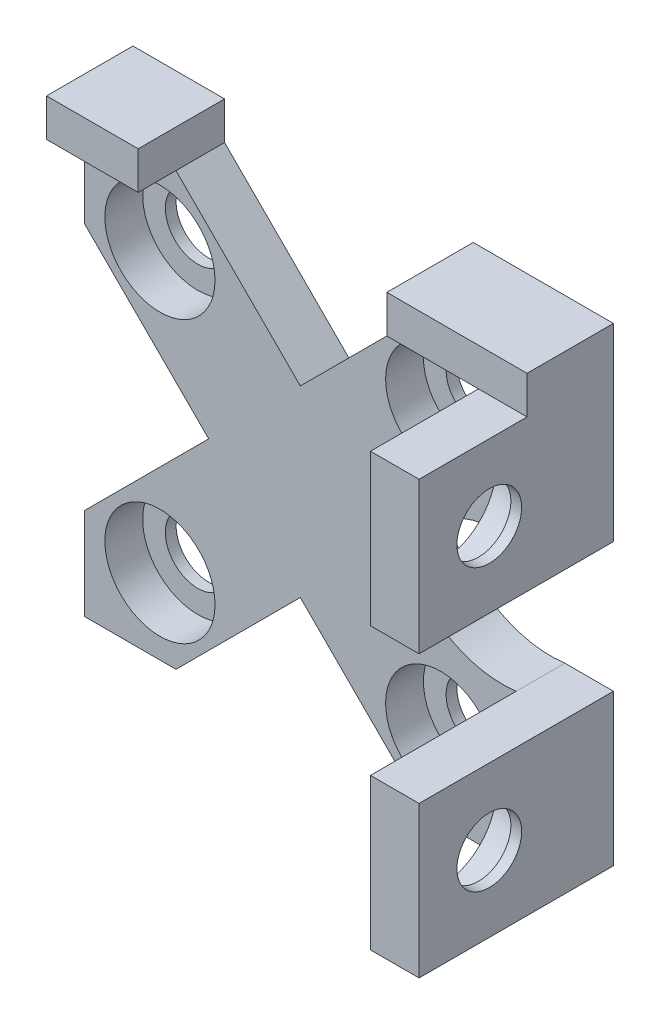
from build123d import *

# Parameters (mm, degrees)
RESSALTO_EXTRUS_O1_DEPTH  = 4.5
ESBO_O2_R                 = 5.1
CORTE_EXTRUS_O1_DEPTH     = 3.5
ESBO_O3_R                 = 3
CORTE_EXTRUS_O2_DEPTH     = 3.5
ESPELHAR2_COPY_1_DEPTH    = 4.5
ESPELHAR2_COPY_2_SKETCH_R = 5.1
ESPELHAR2_COPY_2_DEPTH    = 3.5
ESPELHAR2_COPY_3_SKETCH_R = 3
ESPELHAR2_COPY_3_DEPTH    = 3.5
ESBO_O5_W                 = 18
ESBO_O5_H                 = 14
RESSALTO_EXTRUS_O2_DEPTH  = 4.5
ESBO_O6_R                 = 5.15
CORTE_EXTRUS_O3_DEPTH     = 3.5
ESBO_O7_R                 = 3
CORTE_EXTRUS_O4_DEPTH     = 3.5
FILETE1_R                 = 10
ESBO_O8_W                 = 8.485281374
ESBO_O8_H                 = 8
ESBO_O8_W_2               = 12.985281374
RESSALTO_EXTRUS_O3_DEPTH  = 3.5


with BuildPart() as part:
    # Esboço1 → Ressalto-extrusão1 (new body)
    with BuildSketch(Plane.XY):
        Polygon((-8.485281374, 0), (-20, 11.514718626), (-20, 20), (-11.514718626, 20), (0, 8.485281374), (0, 0), align=None)
    ressalto_extrus_o1 = extrude(amount=RESSALTO_EXTRUS_O1_DEPTH)

    # Esboço2 → Corte-extrusão1 (cut)
    with BuildSketch(Plane.XY.offset(4.5)):
        with Locations((-13, 13)):
            Circle(ESBO_O2_R)
    corte_extrus_o1 = extrude(amount=-CORTE_EXTRUS_O1_DEPTH, mode=Mode.SUBTRACT)

    # Esboço3 → Corte-extrusão2 (cut)
    with BuildSketch(Plane.XY.offset(1)):
        with Locations((-13, 13)):
            Circle(ESBO_O3_R)
    corte_extrus_o2 = extrude(amount=-CORTE_EXTRUS_O2_DEPTH, mode=Mode.SUBTRACT)

    # Espelhar1: Ressalto-extrusão1, Corte-extrusão1, Corte-extrusão2 across plane
    add(ressalto_extrus_o1.mirror(Plane(origin=(0, 0, 0), x_dir=(0, 0, 1), z_dir=(1, 0, 0))))
    add(corte_extrus_o1.mirror(Plane(origin=(0, 0, 0), x_dir=(0, 0, 1), z_dir=(1, 0, 0))), mode=Mode.SUBTRACT)
    add(corte_extrus_o2.mirror(Plane(origin=(0, 0, 0), x_dir=(0, 0, 1), z_dir=(1, 0, 0))), mode=Mode.SUBTRACT)

    # Espelhar2: Ressalto-extrusão1, Corte-extrusão1, Corte-extrusão2 across plane
    add(ressalto_extrus_o1.mirror(Plane.ZX))
    add(corte_extrus_o1.mirror(Plane.ZX), mode=Mode.SUBTRACT)
    add(corte_extrus_o2.mirror(Plane.ZX), mode=Mode.SUBTRACT)

    # Espelhar2 copy 1 sketch → Espelhar2 copy 1 (add)
    with BuildSketch(Plane(origin=(0, 0, 0), x_dir=(-1, 0, 0), z_dir=(0, 0, 1))):
        Polygon((-8.485281374, 0), (-20, 11.514718626), (-20, 20), (-11.514718626, 20), (0, 8.485281374), (0, 0), align=None)
    extrude(amount=ESPELHAR2_COPY_1_DEPTH)

    # Espelhar2 copy 2 sketch → Espelhar2 copy 2 (cut)
    with BuildSketch(Plane(origin=(0, 0, 4.5), x_dir=(-1, 0, 0), z_dir=(0, 0, 1))):
        with Locations((-13, 13)):
            Circle(ESPELHAR2_COPY_2_SKETCH_R)
    extrude(amount=-ESPELHAR2_COPY_2_DEPTH, mode=Mode.SUBTRACT)

    # Espelhar2 copy 3 sketch → Espelhar2 copy 3 (cut)
    with BuildSketch(Plane(origin=(0, 0, 1), x_dir=(-1, 0, 0), z_dir=(0, 0, 1))):
        with Locations((-13, 13)):
            Circle(ESPELHAR2_COPY_3_SKETCH_R)
    extrude(amount=-ESPELHAR2_COPY_3_DEPTH, mode=Mode.SUBTRACT)

    # Esboço5 → Ressalto-extrusão2 (add)
    with BuildSketch(Plane(origin=(20, 0, 0), x_dir=(0, 0, -1), z_dir=(1, 0, 0))):
        with Locations((-9, 13)):
            Rectangle(ESBO_O5_W, ESBO_O5_H)
    ressalto_extrus_o2 = extrude(amount=RESSALTO_EXTRUS_O2_DEPTH)

    # Esboço6 → Corte-extrusão3 (cut)
    with BuildSketch(Plane.ZY.offset(-20)):
        with Locations((11.5, 13)):
            Circle(ESBO_O6_R)
    corte_extrus_o3 = extrude(amount=-CORTE_EXTRUS_O3_DEPTH, mode=Mode.SUBTRACT)

    # Esboço7 → Corte-extrusão4 (cut)
    with BuildSketch(Plane.ZY.offset(-23.5)):
        with Locations((11.5, 13)):
            Circle(ESBO_O7_R)
    corte_extrus_o4 = extrude(amount=-CORTE_EXTRUS_O4_DEPTH, mode=Mode.SUBTRACT)

    # Espelhar3: Ressalto-extrusão2, Corte-extrusão3, Corte-extrusão4 across plane
    add(ressalto_extrus_o2.mirror(Plane.ZX))
    add(corte_extrus_o3.mirror(Plane.ZX), mode=Mode.SUBTRACT)
    add(corte_extrus_o4.mirror(Plane.ZX), mode=Mode.SUBTRACT)

    # Filete1
    # the kernel refuses this fillet: 10 mm, written as the material it adds along each edge
    with BuildSketch(Plane(origin=(20, 11.514718626, 0), x_dir=(0, -1, 0), z_dir=(0, 0, 1))) as filete1_piece_1:
        with BuildLine():
            CenterArc((15.431276309, -1.289140686), FILETE1_R, 172.593154991, 52.406845009)
            Line((8.360208498, -8.360208498), (0, 0))
            Line((0, 0), (5.514718626, 0))
        make_face()
    extrude(amount=4.5)
    with BuildSketch(Plane(origin=(20, -11.514718626, 0), x_dir=(-0.7071067811865462, 0.7071067811865488, 0), z_dir=(0, 0, 1))) as filete1_piece_2:
        with BuildLine():
            CenterArc((11.823120241, -10), FILETE1_R, 90, 52.406845009)
            Line((3.899494937, -3.899494937), (0, 0))
            Line((0, 0), (11.823120241, 0))
        make_face()
    extrude(amount=4.5)

    # Esboço8 → Ressalto-extrusão3 (add)
    with BuildSketch(Plane(origin=(0, 20, 0), x_dir=(1, 0, 0), z_dir=(0, 1, 0))):
        with Locations((-15.757359313, -4)):
            Rectangle(ESBO_O8_W, ESBO_O8_H)
        with Locations((18.007359313, -4)):
            Rectangle(ESBO_O8_W_2, ESBO_O8_H)
    extrude(amount=RESSALTO_EXTRUS_O3_DEPTH)


solid = part.part
